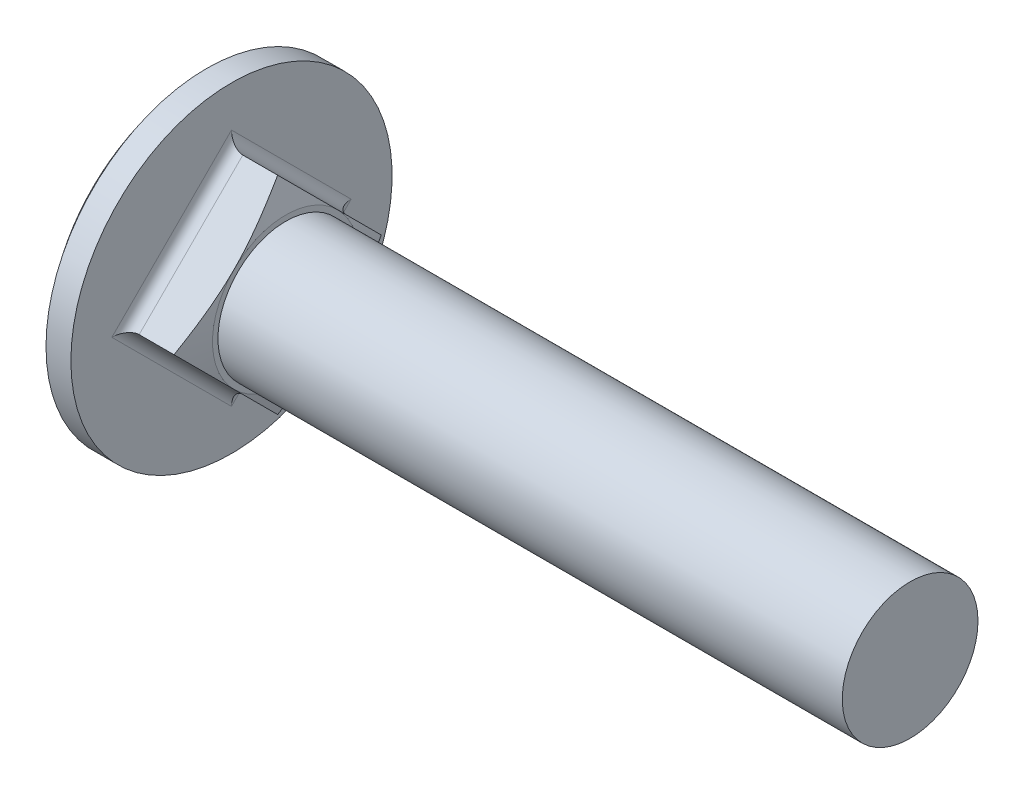
from build123d import *

# Parameters (mm, degrees)
NECK_DEPTH     = 2.4
SKETCH5_R      = 3
BASEBODY_DEPTH = 30
FILLET1_R      = 0.5


with BuildPart() as part:
    # Sketch2 → BaseHead (revolve)
    with BuildSketch(Plane.XY):
        with BuildLine():
            Line((3.6, 0), (3.6, 7.1))
            Line((3.6, 7.1), (2.5, 7.1))
            ThreePointArc((2.5, 7.1), (0.643257137, 3.763641853), (0, 0))
            Line((0, 0), (3.6, 0))
        make_face()
    revolve(axis=Axis((-6.266821244, 0, 0), (1, 0, 0)))

    # Sketch3 → Neck (add)
    with BuildSketch(Plane(origin=(3.6, 0, 0), x_dir=(0, 0, -1), z_dir=(1, 0, 0))):
        Polygon((4.582051942, 0), (0, 4.582051942), (-4.582051942, 0), (0, -4.582051942), align=None)
    extrude(amount=NECK_DEPTH)

    # Sketch4 → Cut-Extrude1 (revolve, cut)
    with BuildSketch(Plane.XY):
        Polygon((6, 4.582051942), (6, 3.24), (5.640398266, 4.582051942), align=None)
    revolve(axis=Axis((2.984818178, 0, 0), (1, 0, 0)), mode=Mode.SUBTRACT)

    # Sketch5 → BaseBody (add)
    with BuildSketch(Plane(origin=(3.6, 0, 0), x_dir=(0, 0, -1), z_dir=(1, 0, 0))):
        Circle(SKETCH5_R)
    extrude(amount=BASEBODY_DEPTH)

    # Fillet1
    fillet1_edges = [part.edges().sort_by_distance(p)[0] for p in [
        (3.6, 2.291025971, -2.291025971),
        (3.6, -2.291025971, -2.291025971),
        (3.6, -2.291025971, 2.291025971),
        (3.6, 2.291025971, 2.291025971),
    ]]
    fillet(fillet1_edges, radius=FILLET1_R)


solid = part.part
